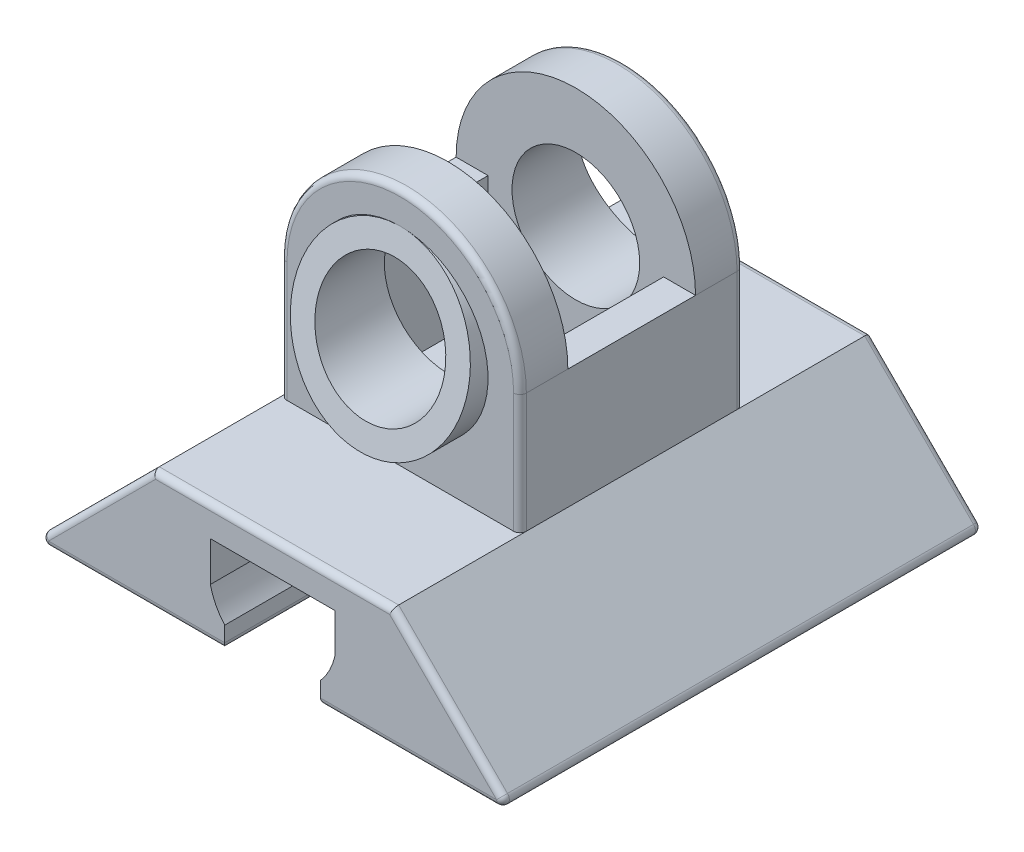
from build123d import *

# Parameters (mm, degrees)
EXTRUDE_1_DEPTH          = 3.5
EXTRUDE_1_DEPTH_BACK     = 3.5
SKETCH_1_R               = 2
EXTRUDE_2_DEPTH          = 7.5
EXTRUDE_2_DEPTH_BACK     = 7.5
CUT_EXTRUDE_1_DEPTH      = 2
CUT_EXTRUDE_1_DEPTH_BACK = 2
SKETCH_4_R               = 2.75
SKETCH_4_R_2             = 2
EXTRUDE_3_DEPTH          = 1.25
EXTRUDE_START            = 1.25
SKETCH_5_R               = 2.75
SKETCH_5_R_2             = 2
EXTRUDE_4_DEPTH          = 1.25
CUT_EXTRUDE_START        = -2.7500001
CUT_EXTRUDE_2_DEPTH      = 5.5000001
CUT_EXTRUDE_3_DEPTH      = 9.45
FILLET_1_R               = 0.2
FILLET_2_R               = 0.2


# Read off the part's stored shape, not the designer's step: 切除-拉伸2
with BuildPart() as part:
    # 草图1 → 凸台-拉伸1 (new, two sides: drawn at the far end of the back side and taken through both)
    with BuildSketch(Plane.XY.offset(-EXTRUDE_1_DEPTH_BACK)):
        with BuildLine():
            Line((-3.75, 7.5), (-3.75, 3.75))
            Line((-3.75, 3.75), (3.75, 3.75))
            Line((3.75, 3.75), (3.75, 7.5))
            ThreePointArc((3.75, 7.5), (0, 11.25), (-3.75, 7.5))
        make_face()
        with Locations((0, 7.5)):
            Circle(SKETCH_1_R, mode=Mode.SUBTRACT)
    extrude(amount=EXTRUDE_1_DEPTH + EXTRUDE_1_DEPTH_BACK)

    # 草图2 → 凸台-拉伸2 (add, two sides: drawn at the far end of the back side and taken through both)
    with BuildSketch(Plane.XY.offset(-EXTRUDE_2_DEPTH_BACK)):
        Polygon((-7.5, 0), (7.5, 0), (3.75, 3.75), (-3.75, 3.75), align=None)
    extrude(amount=EXTRUDE_2_DEPTH + EXTRUDE_2_DEPTH_BACK)

    # 草图3 → 切除-拉伸1 (cut, two sides: drawn at the far end of the back side and taken through both)
    with BuildSketch(Plane.XY.offset(-CUT_EXTRUDE_1_DEPTH_BACK)):
        Polygon((-2.75, 3.75), (2.75, 3.75), (2.75, 7.5), (3.75, 7.5), (3.75, 11.38728412), (-3.75, 11.38728412), (-3.75, 7.5), (-2.75, 7.5), align=None)
    extrude(amount=CUT_EXTRUDE_1_DEPTH + CUT_EXTRUDE_1_DEPTH_BACK, mode=Mode.SUBTRACT)

    # 草图4 → 凸台-拉伸3 (add)
    with BuildSketch(Plane.XY.offset(3.5)):
        with Locations((0, 7.5)):
            Circle(SKETCH_4_R)
        with Locations((0, 7.5)):
            Circle(SKETCH_4_R_2, mode=Mode.SUBTRACT)
    extrude(amount=EXTRUDE_3_DEPTH)

    # 草图5 → 凸台-拉伸4 (add)
    with BuildSketch(Plane(origin=(0, 0, -3.5), x_dir=(-1, 0, 0), z_dir=(0, 0, -1)).offset(EXTRUDE_START)):
        with Locations(Location((0, 7.5, 0), (0, 0, 180))):
            Circle(SKETCH_5_R)
        with Locations(Location((0, 7.5, 0), (0, 0, 180))):
            Circle(SKETCH_5_R_2, mode=Mode.SUBTRACT)
    extrude(amount=-EXTRUDE_4_DEPTH)

    # 切除-拉伸2 outline → 切除-拉伸2 (cut)
    with BuildSketch(Plane(origin=(0, 0, 0), x_dir=(0, 0, -1), z_dir=(1, 0, 0)).offset(CUT_EXTRUDE_START)):
        Polygon((4.75, 10.25), (3.5, 10.25), (4.75, 4.75), align=None)
        Polygon((-4.75, 10.25), (-4.75, 4.75), (-3.5, 10.25), align=None)
    extrude(amount=CUT_EXTRUDE_2_DEPTH, mode=Mode.SUBTRACT)

    # 草图7 → 切除-拉伸3 (cut)
    with BuildSketch(Plane.XY.offset(7.5)):
        with BuildLine():
            Line((-1.5, 0), (-1.5, 0.677124344))
            ThreePointArc((-1.5, 0.677124344), (-1.780042303, 1.088161527), (-1.95, 1.555590279))
            Line((-1.95, 1.555590279), (-1.95, 2.8))
            Line((-1.95, 2.8), (1.95, 2.8))
            Line((1.95, 2.8), (1.95, 1.555590279))
            ThreePointArc((1.95, 1.555590279), (1.780042303, 1.088161527), (1.5, 0.677124344))
            Line((1.5, 0.677124344), (1.5, 0))
            Line((1.5, 0), (-1.5, 0))
        make_face()
    extrude(amount=-CUT_EXTRUDE_3_DEPTH, mode=Mode.SUBTRACT)

    # 圆角1
    fillet_1_edges = [part.edges().sort_by_distance(p)[0] for p in [
        (4.5, 0, 7.5),
        (7.5, 0, 0),
        (0, 0, -7.5),
        (-7.5, 0, 0),
        (-4.5, 0, 7.5),
        (-1.5, 0, 2.775),
        (0, 0, -1.95),
        (1.5, 0, 2.775),
        (5.625, 1.875, -7.5),
        (0, 3.75, -7.5),
        (-5.625, 1.875, -7.5),
        (0, 3.75, 7.5),
        (-5.625, 1.875, 7.5),
        (5.625, 1.875, 7.5),
    ]]
    fillet(fillet_1_edges, radius=FILLET_1_R)

    # 圆角2
    fillet_2_edges = [part.edges().sort_by_distance(p)[0] for p in [
        (-3.75, 5.625, -3.5),
        (3.75, 5.625, -3.5),
        (0, 11.25, -3.5),
        (-3.75, 5.625, 3.5),
        (3.75, 5.625, 3.5),
        (0, 11.25, 3.5),
    ]]
    fillet(fillet_2_edges, radius=FILLET_2_R)


solid = part.part
